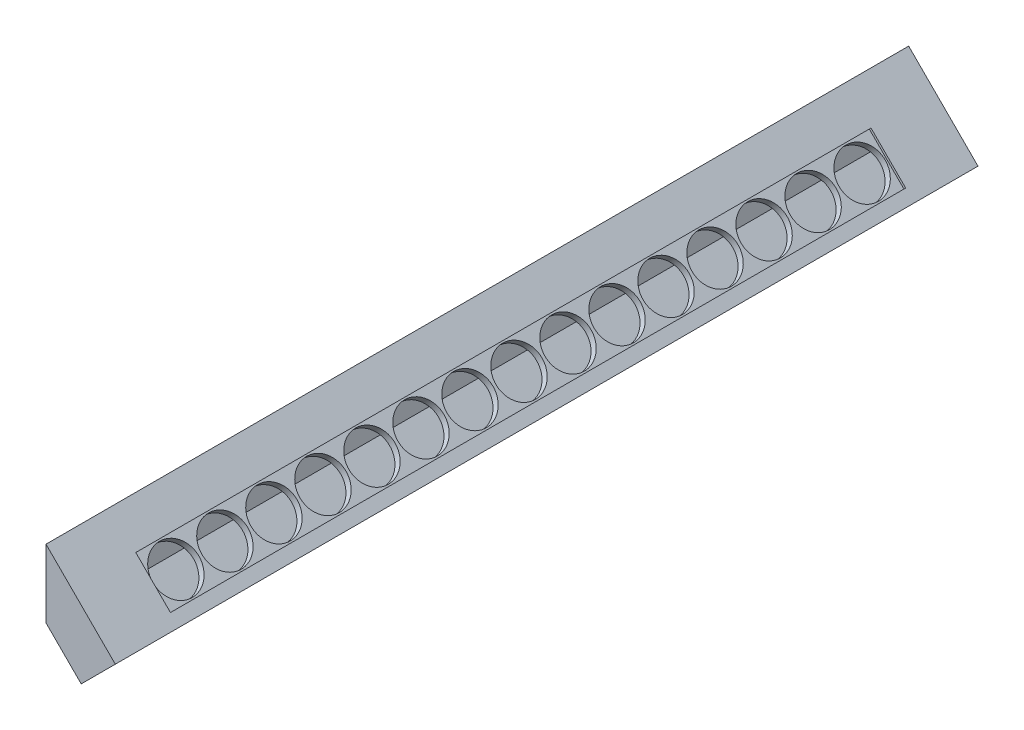
from build123d import *

# Parameters (mm, degrees)
BOSS_EXTRUDE1_DEPTH = 880
CHAMFER1_SIZE       = 50.8
CHAMFER1_SIZE2      = 71.842048969
SKETCH3_W           = 750
SKETCH3_H           = 50
CUT_EXTRUDE1_DEPTH  = 2.5
SKETCH4_R           = 23.5
CUT_EXTRUDE2_DEPTH  = 11.9
SHELL1_START        = -14.4
SHELL1_OUTLINE_W    = 62.4
SHELL1_OUTLINE_H    = 765
SHELL1_OUTLINE_R    = 23.5
SHELL1_DEPTH        = 4.4
SHELL1_START_2      = 7.5
SHELL1_2_DEPTH      = 865
SHELL1_3_DEPTH      = 50
SHELL1_START_3      = 822.5
SHELL1_4_DEPTH      = 50


with BuildPart() as part:
    # Sketch1 → Boss-Extrude1 (new body)
    with BuildSketch(Plane.XY):
        Polygon((-70.710678119, 70.710678119), (-70.710678119, -70.710678119), (0, 0), align=None)
    extrude(amount=BOSS_EXTRUDE1_DEPTH)

    # Chamfer1
    chamfer1_edges = [part.edges().sort_by_distance(p)[0] for p in [
        (-70.710678119, -70.710678119, 440),
    ]]
    chamfer1_side = [part.faces().sort_by_distance(p)[0] for p in [
        (-35.355339059, -35.355339059, 440),
    ]]
    chamfer(chamfer1_edges, length=CHAMFER1_SIZE, length2=CHAMFER1_SIZE2, reference=chamfer1_side[0])

    # Sketch3 → Cut-Extrude1 (cut)
    with BuildSketch(Plane(origin=(0, 0, 0), x_dir=(0, 0, -1), z_dir=(0.7071067811865493, 0.7071067811865457, 0))):
        with Locations((-440, 37.4)):
            Rectangle(SKETCH3_W, SKETCH3_H)
    extrude(amount=-CUT_EXTRUDE1_DEPTH, mode=Mode.SUBTRACT)

    # Sketch4 → Cut-Extrude2 (cut)
    with BuildSketch(Plane(origin=(-1.767766953, -1.767766953, 0), x_dir=(0, 0, -1), z_dir=(0.7071067811865652, 0.7071067811865298, 0))):
        with Locations(Location((-440, 37.4, 0), (0, 0, 90))):
            Circle(SKETCH4_R)
        with Locations(Location((-490, 37.4, 0), (0, 0, 90))):
            Circle(SKETCH4_R)
        with Locations(Location((-540, 37.4, 0), (0, 0, 90))):
            Circle(SKETCH4_R)
        with Locations(Location((-590, 37.4, 0), (0, 0, 90))):
            Circle(SKETCH4_R)
        with Locations(Location((-640, 37.4, 0), (0, 0, 90))):
            Circle(SKETCH4_R)
        with Locations(Location((-690, 37.4, 0), (0, 0, 90))):
            Circle(SKETCH4_R)
        with Locations(Location((-740, 37.4, 0), (0, 0, 90))):
            Circle(SKETCH4_R)
        with Locations(Location((-790, 37.4, 0), (0, 0, 90))):
            Circle(SKETCH4_R)
        with Locations(Location((-390, 37.4, 0), (0, 0, 90))):
            Circle(SKETCH4_R)
        with Locations(Location((-340, 37.4, 0), (0, 0, 90))):
            Circle(SKETCH4_R)
        with Locations(Location((-290, 37.4, 0), (0, 0, 90))):
            Circle(SKETCH4_R)
        with Locations(Location((-240, 37.4, 0), (0, 0, 90))):
            Circle(SKETCH4_R)
        with Locations(Location((-190, 37.4, 0), (0, 0, 90))):
            Circle(SKETCH4_R)
        with Locations(Location((-140, 37.4, 0), (0, 0, 90))):
            Circle(SKETCH4_R)
        with Locations(Location((-90, 37.4, 0), (0, 0, 90))):
            Circle(SKETCH4_R)
    extrude(amount=-CUT_EXTRUDE2_DEPTH, mode=Mode.SUBTRACT)

    # Shell1: read off the stored shape, not the designer's step
    # Shell1 outline → Shell1 (cut)
    with BuildSketch(Plane(origin=(0, 0, 0), x_dir=(0.7071067811865474, -0.7071067811865477, 0), z_dir=(0.7071067811865476, 0.7071067811865476, 0)).offset(SHELL1_START)):
        with Locations((-38.7, -440)):
            Rectangle(SHELL1_OUTLINE_W, SHELL1_OUTLINE_H)
        with Locations((-37.4, -790)):
            Circle(SHELL1_OUTLINE_R, mode=Mode.SUBTRACT)
        with Locations((-37.4, -740)):
            Circle(SHELL1_OUTLINE_R, mode=Mode.SUBTRACT)
        with Locations((-37.4, -690)):
            Circle(SHELL1_OUTLINE_R, mode=Mode.SUBTRACT)
        with Locations((-37.4, -640)):
            Circle(SHELL1_OUTLINE_R, mode=Mode.SUBTRACT)
        with Locations((-37.4, -590)):
            Circle(SHELL1_OUTLINE_R, mode=Mode.SUBTRACT)
        with Locations((-37.4, -540)):
            Circle(SHELL1_OUTLINE_R, mode=Mode.SUBTRACT)
        with Locations((-37.4, -490)):
            Circle(SHELL1_OUTLINE_R, mode=Mode.SUBTRACT)
        with Locations((-37.4, -440)):
            Circle(SHELL1_OUTLINE_R, mode=Mode.SUBTRACT)
        with Locations((-37.4, -390)):
            Circle(SHELL1_OUTLINE_R, mode=Mode.SUBTRACT)
        with Locations((-37.4, -340)):
            Circle(SHELL1_OUTLINE_R, mode=Mode.SUBTRACT)
        with Locations((-37.4, -290)):
            Circle(SHELL1_OUTLINE_R, mode=Mode.SUBTRACT)
        with Locations((-37.4, -240)):
            Circle(SHELL1_OUTLINE_R, mode=Mode.SUBTRACT)
        with Locations((-37.4, -190)):
            Circle(SHELL1_OUTLINE_R, mode=Mode.SUBTRACT)
        with Locations((-37.4, -140)):
            Circle(SHELL1_OUTLINE_R, mode=Mode.SUBTRACT)
        with Locations((-37.4, -90)):
            Circle(SHELL1_OUTLINE_R, mode=Mode.SUBTRACT)
    extrude(amount=SHELL1_DEPTH, mode=Mode.SUBTRACT)

    # Shell1 2 outline → Shell1 2 (cut)
    with BuildSketch(Plane.XY.offset(SHELL1_START_2)):
        Polygon((-54.730064864, 44.123463146), (-63.210678119, 52.604076401), (-63.210678119, 4.237972568), (-34.789653634, -24.183051917), (-15.485638508, -4.87903679), (-59.609101654, 39.244426356), align=None)
    extrude(amount=SHELL1_2_DEPTH, mode=Mode.SUBTRACT)

    # Shell1 3 outline → Shell1 3 (cut)
    with BuildSketch(Plane.XY.offset(SHELL1_START_2)):
        Polygon((-10.606601718, 0), (-54.730064864, 44.123463146), (-59.609101654, 39.244426356), (-15.485638508, -4.87903679), align=None)
    extrude(amount=SHELL1_3_DEPTH, mode=Mode.SUBTRACT)

    # Shell1 4 outline → Shell1 4 (cut)
    with BuildSketch(Plane.XY.offset(SHELL1_START_3)):
        Polygon((-10.606601718, 0), (-54.730064864, 44.123463146), (-59.609101654, 39.244426356), (-15.485638508, -4.87903679), align=None)
    extrude(amount=SHELL1_4_DEPTH, mode=Mode.SUBTRACT)


solid = part.part
